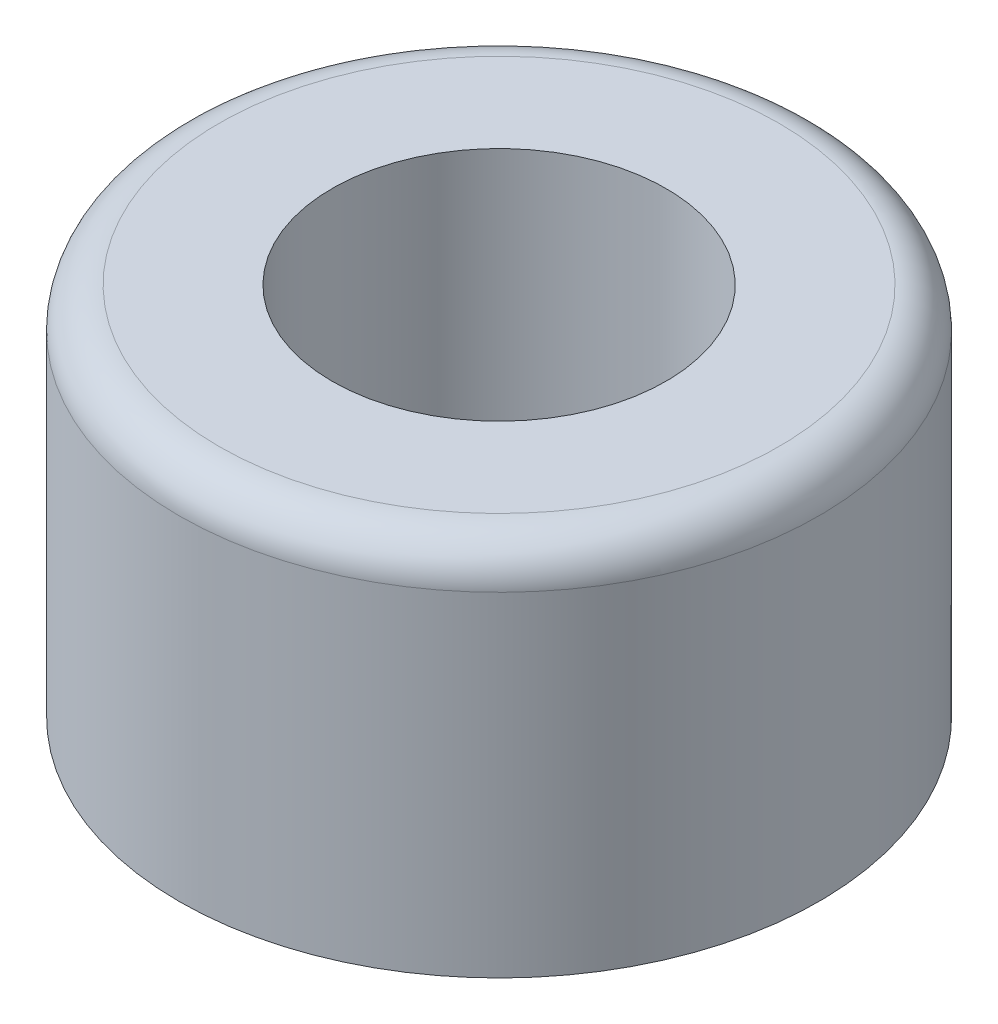
from build123d import *

# Parameters (mm, degrees)
SKETCH1_R      = 4.064
SKETCH1_R_2    = 2.1209
EXTRUDE1_DEPTH = 2.3749
FILLET1_R      = 0.508


with BuildPart() as part:
    # Sketch1 → Extrude1 (new, symmetric)
    with BuildSketch(Plane(origin=(0, 0, 0), x_dir=(1, 0, 0), z_dir=(0, 1, 0))):
        Circle(SKETCH1_R)
        Circle(SKETCH1_R_2, mode=Mode.SUBTRACT)
    extrude(amount=EXTRUDE1_DEPTH, both=True)

    # Fillet1
    fillet1_edges = [part.edges().sort_by_distance(p)[0] for p in [
        (-4.064, 2.3749, 0),
    ]]
    fillet(fillet1_edges, radius=FILLET1_R)


solid = part.part
